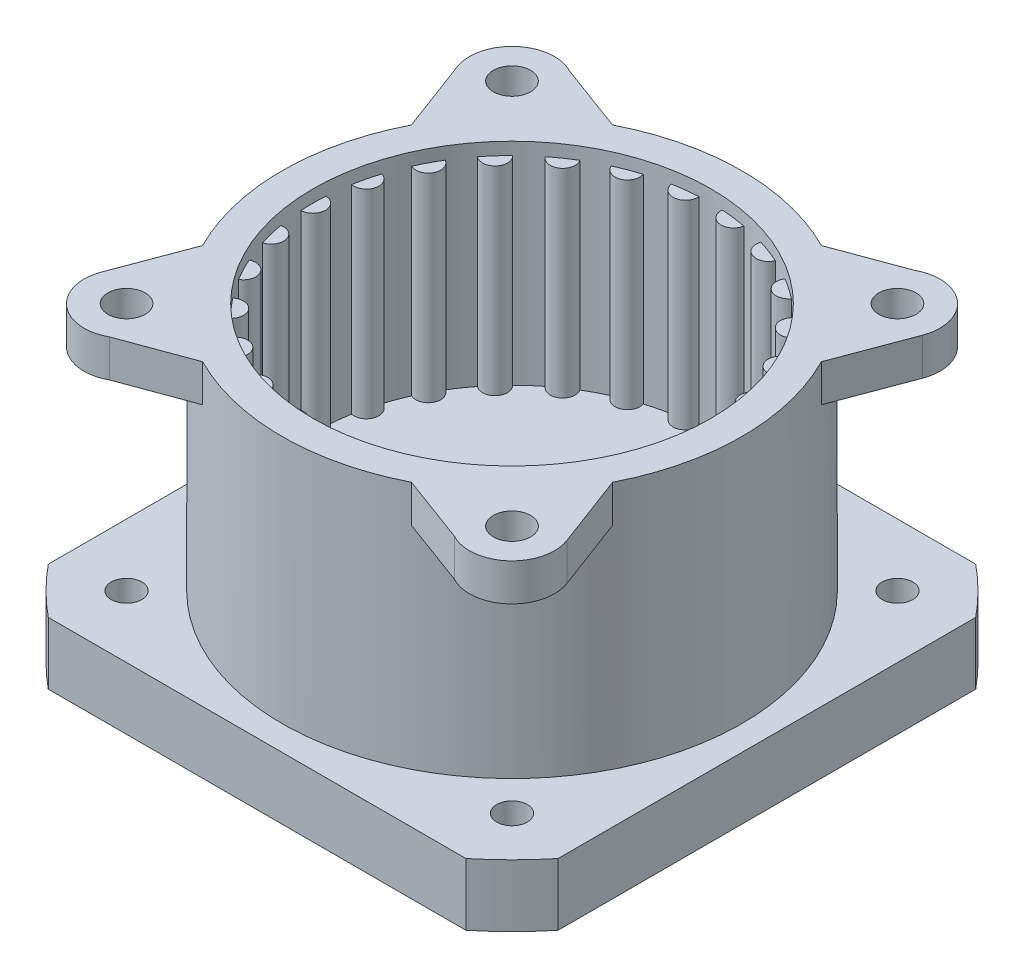
from build123d import *

# Parameters (mm, degrees)
BOSS_EXTRUDE1_DEPTH         = 8
BOSS_EXTRUDE1_DEPTH_BACK    = 8
SKETCH2_R                   = 1
BOSS_EXTRUDE1_2_DEPTH       = 8
BOSS_EXTRUDE1_2_DEPTH_BACK  = 8
BOSS_EXTRUDE1_3_DEPTH       = 8
BOSS_EXTRUDE1_3_DEPTH_BACK  = 8
BOSS_EXTRUDE1_4_DEPTH       = 8
BOSS_EXTRUDE1_4_DEPTH_BACK  = 8
BOSS_EXTRUDE1_5_DEPTH       = 8
BOSS_EXTRUDE1_5_DEPTH_BACK  = 8
BOSS_EXTRUDE1_6_DEPTH       = 8
BOSS_EXTRUDE1_6_DEPTH_BACK  = 8
BOSS_EXTRUDE1_7_DEPTH       = 8
BOSS_EXTRUDE1_7_DEPTH_BACK  = 8
BOSS_EXTRUDE1_8_DEPTH       = 8
BOSS_EXTRUDE1_8_DEPTH_BACK  = 8
BOSS_EXTRUDE1_9_DEPTH       = 8
BOSS_EXTRUDE1_9_DEPTH_BACK  = 8
BOSS_EXTRUDE1_10_DEPTH      = 8
BOSS_EXTRUDE1_10_DEPTH_BACK = 8
BOSS_EXTRUDE1_11_DEPTH      = 8
BOSS_EXTRUDE1_11_DEPTH_BACK = 8
BOSS_EXTRUDE1_12_DEPTH      = 8
BOSS_EXTRUDE1_12_DEPTH_BACK = 8
BOSS_EXTRUDE1_13_DEPTH      = 8
BOSS_EXTRUDE1_13_DEPTH_BACK = 8
BOSS_EXTRUDE1_14_DEPTH      = 8
BOSS_EXTRUDE1_14_DEPTH_BACK = 8
BOSS_EXTRUDE1_15_DEPTH      = 8
BOSS_EXTRUDE1_15_DEPTH_BACK = 8
BOSS_EXTRUDE1_16_DEPTH      = 8
BOSS_EXTRUDE1_16_DEPTH_BACK = 8
BOSS_EXTRUDE1_17_DEPTH      = 8
BOSS_EXTRUDE1_17_DEPTH_BACK = 8
BOSS_EXTRUDE1_18_DEPTH      = 8
BOSS_EXTRUDE1_18_DEPTH_BACK = 8
BOSS_EXTRUDE1_19_DEPTH      = 8
BOSS_EXTRUDE1_19_DEPTH_BACK = 8
BOSS_EXTRUDE1_20_DEPTH      = 8
BOSS_EXTRUDE1_20_DEPTH_BACK = 8
BOSS_EXTRUDE1_21_DEPTH      = 8
BOSS_EXTRUDE1_21_DEPTH_BACK = 8
BOSS_EXTRUDE1_22_DEPTH      = 8
BOSS_EXTRUDE1_22_DEPTH_BACK = 8
BOSS_EXTRUDE1_23_DEPTH      = 8
BOSS_EXTRUDE1_23_DEPTH_BACK = 8
BOSS_EXTRUDE1_24_DEPTH      = 8
BOSS_EXTRUDE1_24_DEPTH_BACK = 8
BOSS_EXTRUDE1_25_DEPTH      = 8
BOSS_EXTRUDE1_25_DEPTH_BACK = 8
BOSS_EXTRUDE1_26_DEPTH      = 8
BOSS_EXTRUDE1_26_DEPTH_BACK = 8
BOSS_EXTRUDE3_DEPTH         = 8
BOSS_EXTRUDE3_DEPTH_BACK    = 8
SKETCH5_R                   = 18.5
SKETCH5_R_2                 = 16
SKETCH6_R                   = 18.5
SKETCH6_R_2                 = 16
BOSS_EXTRUDE4_DEPTH         = 1
BOSS_EXTRUDE5_START         = 3
SKETCH8_R                   = 18.5
BOSS_EXTRUDE5_DEPTH         = 3
SKETCH9_R                   = 6
CUT_EXTRUDE1_DEPTH          = 3
BOSS_EXTRUDE7_START         = 5
SKETCH13_R                  = 1.23
SKETCH13_R_2                = 6
BOSS_EXTRUDE7_DEPTH         = 5
BOSS_EXTRUDE9_START         = -3
SKETCH14_R                  = 1.5
BOSS_EXTRUDE9_DEPTH         = 3


with BuildPart() as part:
    # Sketch2 → Boss-Extrude1 (new, two sides: drawn at the far end of the back side and taken through both)
    with BuildSketch(Plane(origin=(0, 0, 0), x_dir=(1, 0, 0), z_dir=(0, 1, 0)).offset(-BOSS_EXTRUDE1_DEPTH_BACK)):
        with Locations((15.5, 0)):
            Circle(SKETCH2_R)
    extrude(amount=BOSS_EXTRUDE1_DEPTH + BOSS_EXTRUDE1_DEPTH_BACK)



with BuildPart() as body_2:
    # Sketch2 → Boss-Extrude1 2 (new, two sides: drawn at the far end of the back side and taken through both)
    with BuildSketch(Plane(origin=(0, 0, 0), x_dir=(1, 0, 0), z_dir=(0, 1, 0)).offset(-BOSS_EXTRUDE1_2_DEPTH_BACK)):
        with Locations((15.035069079, -3.829050629)):
            Circle(SKETCH2_R)
    extrude(amount=BOSS_EXTRUDE1_2_DEPTH + BOSS_EXTRUDE1_2_DEPTH_BACK)


with BuildPart() as body_3:
    # Sketch2 → Boss-Extrude1 3 (new, two sides: drawn at the far end of the back side and taken through both)
    with BuildSketch(Plane(origin=(0, 0, 0), x_dir=(1, 0, 0), z_dir=(0, 1, 0)).offset(-BOSS_EXTRUDE1_3_DEPTH_BACK)):
        with Locations((13.66729641, -7.435570753)):
            Circle(SKETCH2_R)
    extrude(amount=BOSS_EXTRUDE1_3_DEPTH + BOSS_EXTRUDE1_3_DEPTH_BACK)


with BuildPart() as body_4:
    # Sketch2 → Boss-Extrude1 4 (new, two sides: drawn at the far end of the back side and taken through both)
    with BuildSketch(Plane(origin=(0, 0, 0), x_dir=(1, 0, 0), z_dir=(0, 1, 0)).offset(-BOSS_EXTRUDE1_4_DEPTH_BACK)):
        with Locations((11.476171971, -10.609962532)):
            Circle(SKETCH2_R)
    extrude(amount=BOSS_EXTRUDE1_4_DEPTH + BOSS_EXTRUDE1_4_DEPTH_BACK)


with BuildPart() as body_5:
    # Sketch2 → Boss-Extrude1 5 (new, two sides: drawn at the far end of the back side and taken through both)
    with BuildSketch(Plane(origin=(0, 0, 0), x_dir=(1, 0, 0), z_dir=(0, 1, 0)).offset(-BOSS_EXTRUDE1_5_DEPTH_BACK)):
        with Locations((8.589035948, -13.167741854)):
            Circle(SKETCH2_R)
    extrude(amount=BOSS_EXTRUDE1_5_DEPTH + BOSS_EXTRUDE1_5_DEPTH_BACK)


with BuildPart() as body_6:
    # Sketch2 → Boss-Extrude1 6 (new, two sides: drawn at the far end of the back side and taken through both)
    with BuildSketch(Plane(origin=(0, 0, 0), x_dir=(1, 0, 0), z_dir=(0, 1, 0)).offset(-BOSS_EXTRUDE1_6_DEPTH_BACK)):
        with Locations((5.173678193, -14.960259883)):
            Circle(SKETCH2_R)
    extrude(amount=BOSS_EXTRUDE1_6_DEPTH + BOSS_EXTRUDE1_6_DEPTH_BACK)


with BuildPart() as body_7:
    # Sketch2 → Boss-Extrude1 7 (new, two sides: drawn at the far end of the back side and taken through both)
    with BuildSketch(Plane(origin=(0, 0, 0), x_dir=(1, 0, 0), z_dir=(0, 1, 0)).offset(-BOSS_EXTRUDE1_7_DEPTH_BACK)):
        with Locations((1.428586884, -15.883341986)):
            Circle(SKETCH2_R)
    extrude(amount=BOSS_EXTRUDE1_7_DEPTH + BOSS_EXTRUDE1_7_DEPTH_BACK)


with BuildPart() as body_8:
    # Sketch2 → Boss-Extrude1 8 (new, two sides: drawn at the far end of the back side and taken through both)
    with BuildSketch(Plane(origin=(0, 0, 0), x_dir=(1, 0, 0), z_dir=(0, 1, 0)).offset(-BOSS_EXTRUDE1_8_DEPTH_BACK)):
        with Locations((-2.428586884, -15.883341986)):
            Circle(SKETCH2_R)
    extrude(amount=BOSS_EXTRUDE1_8_DEPTH + BOSS_EXTRUDE1_8_DEPTH_BACK)


with BuildPart() as body_9:
    # Sketch2 → Boss-Extrude1 9 (new, two sides: drawn at the far end of the back side and taken through both)
    with BuildSketch(Plane(origin=(0, 0, 0), x_dir=(1, 0, 0), z_dir=(0, 1, 0)).offset(-BOSS_EXTRUDE1_9_DEPTH_BACK)):
        with Locations((-6.173678193, -14.960259883)):
            Circle(SKETCH2_R)
    extrude(amount=BOSS_EXTRUDE1_9_DEPTH + BOSS_EXTRUDE1_9_DEPTH_BACK)


with BuildPart() as body_10:
    # Sketch2 → Boss-Extrude1 10 (new, two sides: drawn at the far end of the back side and taken through both)
    with BuildSketch(Plane(origin=(0, 0, 0), x_dir=(1, 0, 0), z_dir=(0, 1, 0)).offset(-BOSS_EXTRUDE1_10_DEPTH_BACK)):
        with Locations((-9.589035948, -13.167741854)):
            Circle(SKETCH2_R)
    extrude(amount=BOSS_EXTRUDE1_10_DEPTH + BOSS_EXTRUDE1_10_DEPTH_BACK)


with BuildPart() as body_11:
    # Sketch2 → Boss-Extrude1 11 (new, two sides: drawn at the far end of the back side and taken through both)
    with BuildSketch(Plane(origin=(0, 0, 0), x_dir=(1, 0, 0), z_dir=(0, 1, 0)).offset(-BOSS_EXTRUDE1_11_DEPTH_BACK)):
        with Locations((-12.476171971, -10.609962532)):
            Circle(SKETCH2_R)
    extrude(amount=BOSS_EXTRUDE1_11_DEPTH + BOSS_EXTRUDE1_11_DEPTH_BACK)


with BuildPart() as body_12:
    # Sketch2 → Boss-Extrude1 12 (new, two sides: drawn at the far end of the back side and taken through both)
    with BuildSketch(Plane(origin=(0, 0, 0), x_dir=(1, 0, 0), z_dir=(0, 1, 0)).offset(-BOSS_EXTRUDE1_12_DEPTH_BACK)):
        with Locations((-14.66729641, -7.435570753)):
            Circle(SKETCH2_R)
    extrude(amount=BOSS_EXTRUDE1_12_DEPTH + BOSS_EXTRUDE1_12_DEPTH_BACK)


with BuildPart() as body_13:
    # Sketch2 → Boss-Extrude1 13 (new, two sides: drawn at the far end of the back side and taken through both)
    with BuildSketch(Plane(origin=(0, 0, 0), x_dir=(1, 0, 0), z_dir=(0, 1, 0)).offset(-BOSS_EXTRUDE1_13_DEPTH_BACK)):
        with Locations((-16.035069079, -3.829050629)):
            Circle(SKETCH2_R)
    extrude(amount=BOSS_EXTRUDE1_13_DEPTH + BOSS_EXTRUDE1_13_DEPTH_BACK)


with BuildPart() as body_14:
    # Sketch2 → Boss-Extrude1 14 (new, two sides: drawn at the far end of the back side and taken through both)
    with BuildSketch(Plane(origin=(0, 0, 0), x_dir=(1, 0, 0), z_dir=(0, 1, 0)).offset(-BOSS_EXTRUDE1_14_DEPTH_BACK)):
        with Locations((-16.5, 0)):
            Circle(SKETCH2_R)
    extrude(amount=BOSS_EXTRUDE1_14_DEPTH + BOSS_EXTRUDE1_14_DEPTH_BACK)


with BuildPart() as body_15:
    # Sketch2 → Boss-Extrude1 15 (new, two sides: drawn at the far end of the back side and taken through both)
    with BuildSketch(Plane(origin=(0, 0, 0), x_dir=(1, 0, 0), z_dir=(0, 1, 0)).offset(-BOSS_EXTRUDE1_15_DEPTH_BACK)):
        with Locations((-16.035069079, 3.829050629)):
            Circle(SKETCH2_R)
    extrude(amount=BOSS_EXTRUDE1_15_DEPTH + BOSS_EXTRUDE1_15_DEPTH_BACK)


with BuildPart() as body_16:
    # Sketch2 → Boss-Extrude1 16 (new, two sides: drawn at the far end of the back side and taken through both)
    with BuildSketch(Plane(origin=(0, 0, 0), x_dir=(1, 0, 0), z_dir=(0, 1, 0)).offset(-BOSS_EXTRUDE1_16_DEPTH_BACK)):
        with Locations((-14.66729641, 7.435570753)):
            Circle(SKETCH2_R)
    extrude(amount=BOSS_EXTRUDE1_16_DEPTH + BOSS_EXTRUDE1_16_DEPTH_BACK)


with BuildPart() as body_17:
    # Sketch2 → Boss-Extrude1 17 (new, two sides: drawn at the far end of the back side and taken through both)
    with BuildSketch(Plane(origin=(0, 0, 0), x_dir=(1, 0, 0), z_dir=(0, 1, 0)).offset(-BOSS_EXTRUDE1_17_DEPTH_BACK)):
        with Locations((-12.476171971, 10.609962532)):
            Circle(SKETCH2_R)
    extrude(amount=BOSS_EXTRUDE1_17_DEPTH + BOSS_EXTRUDE1_17_DEPTH_BACK)


with BuildPart() as body_18:
    # Sketch2 → Boss-Extrude1 18 (new, two sides: drawn at the far end of the back side and taken through both)
    with BuildSketch(Plane(origin=(0, 0, 0), x_dir=(1, 0, 0), z_dir=(0, 1, 0)).offset(-BOSS_EXTRUDE1_18_DEPTH_BACK)):
        with Locations((-9.589035948, 13.167741854)):
            Circle(SKETCH2_R)
    extrude(amount=BOSS_EXTRUDE1_18_DEPTH + BOSS_EXTRUDE1_18_DEPTH_BACK)


with BuildPart() as body_19:
    # Sketch2 → Boss-Extrude1 19 (new, two sides: drawn at the far end of the back side and taken through both)
    with BuildSketch(Plane(origin=(0, 0, 0), x_dir=(1, 0, 0), z_dir=(0, 1, 0)).offset(-BOSS_EXTRUDE1_19_DEPTH_BACK)):
        with Locations((-6.173678193, 14.960259883)):
            Circle(SKETCH2_R)
    extrude(amount=BOSS_EXTRUDE1_19_DEPTH + BOSS_EXTRUDE1_19_DEPTH_BACK)


with BuildPart() as body_20:
    # Sketch2 → Boss-Extrude1 20 (new, two sides: drawn at the far end of the back side and taken through both)
    with BuildSketch(Plane(origin=(0, 0, 0), x_dir=(1, 0, 0), z_dir=(0, 1, 0)).offset(-BOSS_EXTRUDE1_20_DEPTH_BACK)):
        with Locations((-2.428586884, 15.883341986)):
            Circle(SKETCH2_R)
    extrude(amount=BOSS_EXTRUDE1_20_DEPTH + BOSS_EXTRUDE1_20_DEPTH_BACK)


with BuildPart() as body_21:
    # Sketch2 → Boss-Extrude1 21 (new, two sides: drawn at the far end of the back side and taken through both)
    with BuildSketch(Plane(origin=(0, 0, 0), x_dir=(1, 0, 0), z_dir=(0, 1, 0)).offset(-BOSS_EXTRUDE1_21_DEPTH_BACK)):
        with Locations((1.428586884, 15.883341986)):
            Circle(SKETCH2_R)
    extrude(amount=BOSS_EXTRUDE1_21_DEPTH + BOSS_EXTRUDE1_21_DEPTH_BACK)


with BuildPart() as body_22:
    # Sketch2 → Boss-Extrude1 22 (new, two sides: drawn at the far end of the back side and taken through both)
    with BuildSketch(Plane(origin=(0, 0, 0), x_dir=(1, 0, 0), z_dir=(0, 1, 0)).offset(-BOSS_EXTRUDE1_22_DEPTH_BACK)):
        with Locations((5.173678193, 14.960259883)):
            Circle(SKETCH2_R)
    extrude(amount=BOSS_EXTRUDE1_22_DEPTH + BOSS_EXTRUDE1_22_DEPTH_BACK)


with BuildPart() as body_23:
    # Sketch2 → Boss-Extrude1 23 (new, two sides: drawn at the far end of the back side and taken through both)
    with BuildSketch(Plane(origin=(0, 0, 0), x_dir=(1, 0, 0), z_dir=(0, 1, 0)).offset(-BOSS_EXTRUDE1_23_DEPTH_BACK)):
        with Locations((8.589035948, 13.167741854)):
            Circle(SKETCH2_R)
    extrude(amount=BOSS_EXTRUDE1_23_DEPTH + BOSS_EXTRUDE1_23_DEPTH_BACK)


with BuildPart() as body_24:
    # Sketch2 → Boss-Extrude1 24 (new, two sides: drawn at the far end of the back side and taken through both)
    with BuildSketch(Plane(origin=(0, 0, 0), x_dir=(1, 0, 0), z_dir=(0, 1, 0)).offset(-BOSS_EXTRUDE1_24_DEPTH_BACK)):
        with Locations((11.476171971, 10.609962532)):
            Circle(SKETCH2_R)
    extrude(amount=BOSS_EXTRUDE1_24_DEPTH + BOSS_EXTRUDE1_24_DEPTH_BACK)


with BuildPart() as body_25:
    # Sketch2 → Boss-Extrude1 25 (new, two sides: drawn at the far end of the back side and taken through both)
    with BuildSketch(Plane(origin=(0, 0, 0), x_dir=(1, 0, 0), z_dir=(0, 1, 0)).offset(-BOSS_EXTRUDE1_25_DEPTH_BACK)):
        with Locations((13.66729641, 7.435570753)):
            Circle(SKETCH2_R)
    extrude(amount=BOSS_EXTRUDE1_25_DEPTH + BOSS_EXTRUDE1_25_DEPTH_BACK)


with BuildPart() as body_26:
    # Sketch2 → Boss-Extrude1 26 (new, two sides: drawn at the far end of the back side and taken through both)
    with BuildSketch(Plane(origin=(0, 0, 0), x_dir=(1, 0, 0), z_dir=(0, 1, 0)).offset(-BOSS_EXTRUDE1_26_DEPTH_BACK)):
        with Locations((15.035069079, 3.829050629)):
            Circle(SKETCH2_R)
    extrude(amount=BOSS_EXTRUDE1_26_DEPTH + BOSS_EXTRUDE1_26_DEPTH_BACK)


with BuildPart() as part_1:
    add(part.part)

    add(body_2.part)  # Boss-Extrude3 merges body 2

    add(body_3.part)  # Boss-Extrude3 merges body 3

    add(body_4.part)  # Boss-Extrude3 merges body 4

    add(body_5.part)  # Boss-Extrude3 merges body 5

    add(body_6.part)  # Boss-Extrude3 merges body 6

    add(body_7.part)  # Boss-Extrude3 merges body 7

    add(body_8.part)  # Boss-Extrude3 merges body 8

    add(body_9.part)  # Boss-Extrude3 merges body 9

    add(body_10.part)  # Boss-Extrude3 merges body 10

    add(body_11.part)  # Boss-Extrude3 merges body 11

    add(body_12.part)  # Boss-Extrude3 merges body 12

    add(body_13.part)  # Boss-Extrude3 merges body 13

    add(body_14.part)  # Boss-Extrude3 merges body 14

    add(body_15.part)  # Boss-Extrude3 merges body 15

    add(body_16.part)  # Boss-Extrude3 merges body 16

    add(body_17.part)  # Boss-Extrude3 merges body 17

    add(body_18.part)  # Boss-Extrude3 merges body 18

    add(body_19.part)  # Boss-Extrude3 merges body 19

    add(body_20.part)  # Boss-Extrude3 merges body 20

    add(body_21.part)  # Boss-Extrude3 merges body 21

    add(body_22.part)  # Boss-Extrude3 merges body 22

    add(body_23.part)  # Boss-Extrude3 merges body 23

    add(body_24.part)  # Boss-Extrude3 merges body 24

    add(body_25.part)  # Boss-Extrude3 merges body 25

    add(body_26.part)  # Boss-Extrude3 merges body 26
    # Sketch5 → Boss-Extrude3 (add, two sides: drawn at the far end of the back side and taken through both)
    with BuildSketch(Plane(origin=(0, 0, 0), x_dir=(1, 0, 0), z_dir=(0, 1, 0)).offset(-BOSS_EXTRUDE3_DEPTH_BACK)):
        with Locations((-0.5, 0)):
            Circle(SKETCH5_R)
        with Locations((-0.5, 0)):
            Circle(SKETCH5_R_2, mode=Mode.SUBTRACT)
    extrude(amount=BOSS_EXTRUDE3_DEPTH + BOSS_EXTRUDE3_DEPTH_BACK)

    # Sketch6 → Boss-Extrude4 (add)
    with BuildSketch(Plane(origin=(0, 8, 0), x_dir=(1, 0, 0), z_dir=(0, 1, 0))):
        with Locations((-0.5, 0)):
            Circle(SKETCH6_R)
        with Locations((-0.5, 0)):
            Circle(SKETCH6_R_2, mode=Mode.SUBTRACT)
    extrude(amount=BOSS_EXTRUDE4_DEPTH)

    # Sketch8 → Boss-Extrude5 (add)
    with BuildSketch(Plane.XZ.offset(8).offset(BOSS_EXTRUDE5_START)):
        with Locations((-0.5, 0)):
            Circle(SKETCH8_R)
    extrude(amount=-BOSS_EXTRUDE5_DEPTH)

    # Sketch9 → Cut-Extrude1 (cut)
    with BuildSketch(Plane.XZ.offset(11)):
        with Locations((-0.5, 0)):
            Circle(SKETCH9_R)
    extrude(amount=-CUT_EXTRUDE1_DEPTH, mode=Mode.SUBTRACT)

    # Sketch13 → Boss-Extrude7 (add)
    with BuildSketch(Plane.XZ.offset(11).offset(BOSS_EXTRUDE7_START)):
        with BuildLine():
            Line((-17.292855624, -20.5), (16.292855624, -20.5))
            ThreePointArc((16.292855624, -20.5), (18.238329701, -18.738329701), (20, -16.792855624))
            Line((20, -16.792855624), (20, 16.792855624))
            ThreePointArc((20, 16.792855624), (18.238329701, 18.738329701), (16.292855624, 20.5))
            Line((16.292855624, 20.5), (-17.292855624, 20.5))
            ThreePointArc((-17.292855624, 20.5), (-19.238329701, 18.738329701), (-21, 16.792855624))
            Line((-21, 16.792855624), (-21, -16.792855624))
            ThreePointArc((-21, -16.792855624), (-19.238329701, -18.738329701), (-17.292855624, -20.5))
        make_face()
        with Locations((-16, -15.5)):
            Circle(SKETCH13_R, mode=Mode.SUBTRACT)
        with Locations((15, -15.5)):
            Circle(SKETCH13_R, mode=Mode.SUBTRACT)
        with Locations((15, 15.5)):
            Circle(SKETCH13_R, mode=Mode.SUBTRACT)
        with Locations((-16, 15.5)):
            Circle(SKETCH13_R, mode=Mode.SUBTRACT)
        with Locations((-0.5, 0)):
            Circle(SKETCH13_R_2, mode=Mode.SUBTRACT)
    extrude(amount=-BOSS_EXTRUDE7_DEPTH)

    # Sketch14 → Boss-Extrude9 (add)
    # profile 1 of 4: a face of its own
    with BuildSketch(Plane(origin=(0, 9, 0), x_dir=(1, 0, 0), z_dir=(0, 1, 0)).offset(BOSS_EXTRUDE9_START)):
        with BuildLine():
            ThreePointArc((-16.98620115, 8.393757897), (-13.581475452, 13.081475452), (-8.893757897, 16.48620115))
            Line((-8.893757897, 16.48620115), (-14.357282137, 18.5))
            ThreePointArc((-14.357282137, 18.5), (-18.240947793, 18.08392627), (-19.20220612, 14.29816892))
            Line((-19.20220612, 14.29816892), (-16.98620115, 8.393757897))
        make_face()
        with Locations((-16, 15.5)):
            Circle(SKETCH14_R, mode=Mode.SUBTRACT)
    # profile 2 of 4: a face of its own
    with BuildSketch(Plane(origin=(0, 9, 0), x_dir=(1, 0, 0), z_dir=(0, 1, 0)).offset(BOSS_EXTRUDE9_START)):
        with BuildLine():
            Line((13.357282137, 18.5), (7.893757897, 16.48620115))
            ThreePointArc((7.893757897, 16.48620115), (12.581475452, 13.081475452), (15.98620115, 8.393757897))
            Line((15.98620115, 8.393757897), (18.20220612, 14.29816892))
            ThreePointArc((18.20220612, 14.29816892), (17.240947793, 18.08392627), (13.357282137, 18.5))
        make_face()
        with Locations((15, 15.5)):
            Circle(SKETCH14_R, mode=Mode.SUBTRACT)
    # profile 3 of 4: a face of its own
    with BuildSketch(Plane(origin=(0, 9, 0), x_dir=(1, 0, 0), z_dir=(0, 1, 0)).offset(BOSS_EXTRUDE9_START)):
        with BuildLine():
            ThreePointArc((-8.893757897, -16.48620115), (-13.581475452, -13.081475452), (-16.98620115, -8.393757897))
            Line((-16.98620115, -8.393757897), (-19.20220612, -14.29816892))
            ThreePointArc((-19.20220612, -14.29816892), (-18.240947793, -18.08392627), (-14.357282137, -18.5))
            Line((-14.357282137, -18.5), (-8.893757897, -16.48620115))
        make_face()
        with Locations((-16, -15.5)):
            Circle(SKETCH14_R, mode=Mode.SUBTRACT)
    # profile 4 of 4: a face of its own
    with BuildSketch(Plane(origin=(0, 9, 0), x_dir=(1, 0, 0), z_dir=(0, 1, 0)).offset(BOSS_EXTRUDE9_START)):
        with BuildLine():
            ThreePointArc((15.98620115, -8.393757897), (12.581475452, -13.081475452), (7.893757897, -16.48620115))
            Line((7.893757897, -16.48620115), (13.357282137, -18.5))
            ThreePointArc((13.357282137, -18.5), (17.240947793, -18.08392627), (18.20220612, -14.29816892))
            Line((18.20220612, -14.29816892), (15.98620115, -8.393757897))
        make_face()
        with Locations((15, -15.5)):
            Circle(SKETCH14_R, mode=Mode.SUBTRACT)
    extrude(amount=BOSS_EXTRUDE9_DEPTH)


solid = part_1.part
